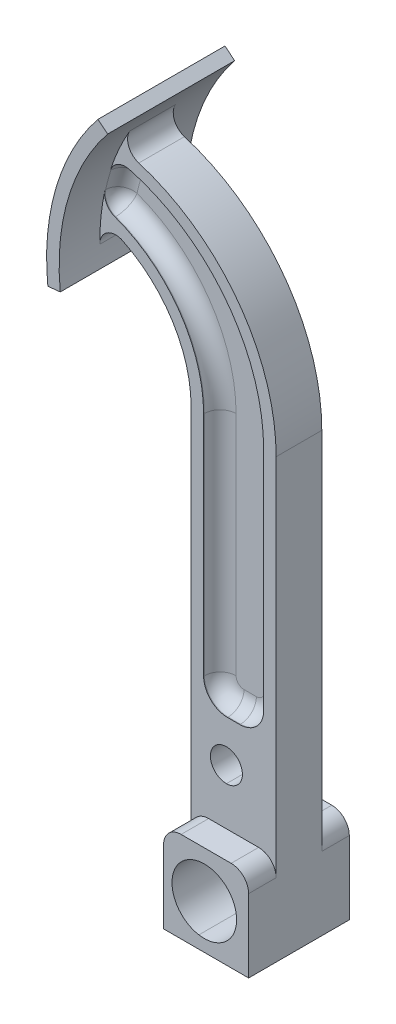
from build123d import *
from build123d.topology import SkipClean

# Parameters (mm, degrees)
SKETCH2_R               = 6.3999999999999995
SKETCH2_R_2             = 12.920000000000002
BOSS_EXTRUDE1_DEPTH     = 20.125
BOSS_EXTRUDE2_DEPTH     = 25.4
CUT_EXTRUDE1_DEPTH      = 17.625
FILLET2_R               = 9.525
FILLET1_R               = 6.35
FILLET2_OF_MIRROR1_R    = 9.525
FILLET1_OF_MIRROR1_R    = 6.35
CUT_EXTRUDE3_REACH      = 230.532
CUT_EXTRUDE3_END_RADIUS = 87.85596312436087
CUT_EXTRUDE4_DEPTH      = 34
FILLET3_R               = 6.35
CUT_EXTRUDE6_DEPTH      = 11
FILLET4_R               = 7


with BuildPart() as part:
    # Sketch2 → Boss-Extrude1 (new, symmetric)
    with BuildSketch(Plane.XY):
        with BuildLine():
            Line((-14.110000000000005, 117.05420999809479), (-14.110000000000003, 39.41472795492869))
            Line((-14.110000000000003, 39.41472795492869), (-14.109999999999992, -58.249999999999986))
            Line((-14.109999999999992, -58.24999999999999), (19.890000000000008, -58.24999999999999))
            Line((19.89000000000001, -58.24999999999999), (19.89000000000001, 39.414727954928686))
            Line((19.89000000000001, 39.41472795492869), (19.89000000000001, 116.74999999999999))
            ThreePointArc((19.890000000000022, 116.74999999999999), (2.3016026864285166, 165.96310053609741), (-42.49516565662927, 192.88020532941604))
            ThreePointArc((-42.49516565662924, 192.88020532941601), (-47.59126491681772, 178.8312081202326), (-50.2324931256602, 164.12173961174625))
            ThreePointArc((-50.23249312566025, 164.12173961174625), (-24.181503081041093, 146.71979128999487), (-14.110000000000007, 117.05420999809479))
        make_face()
        Circle(SKETCH2_R, mode=Mode.SUBTRACT)
        with Locations((2.160000000000005, -40.52)):
            Circle(SKETCH2_R_2, mode=Mode.SUBTRACT)
    extrude(amount=BOSS_EXTRUDE1_DEPTH, both=True)

    # Sketch2<3> → Boss-Extrude2 (add, symmetric)
    with BuildSketch(Plane.XY):
        with BuildLine():
            Line((-55.11000000000002, 146.4), (-50.13682514315135, 146.9172348047148))
            ThreePointArc((-50.13682514315135, 146.9172348047148), (-47.01837422138325, 180.86294224819565), (-31.213761902356293, 211.06641919101017))
            Line((-31.213761902356293, 211.06641919101017), (-35.11000000000003, 214.2))
            ThreePointArc((-35.11000000000003, 214.2), (-51.814073878435075, 182.27760291399264), (-55.11000000000002, 146.4))
        make_face()
    extrude(amount=BOSS_EXTRUDE2_DEPTH, both=True)

    # Sketch3 → Cut-Extrude1 (cut)
    with BuildSketch(Plane.XY.offset(20.125)):
        with BuildLine():
            Line((-9.109999999999992, 16.74326446705436), (-9.110000000000003, 117.05420999809479))
            ThreePointArc((-9.110000000000003, 117.05420999809479), (-20.430838112311193, 150.0432736077851), (-49.62239933784868, 169.12972028140788))
            ThreePointArc((-49.62239933784868, 169.12972028140788), (-47.60047450986274, 178.79694990145757), (-44.50629280792827, 188.17615819065796))
            ThreePointArc((-44.50629280792827, 188.17615819065796), (-1.899187077854016, 163.1978623652425), (14.890000000000011, 116.74999999999999))
            Line((14.890000000000011, 116.74999999999999), (14.890000000000011, 16.74326446705436))
            Line((14.890000000000011, 16.74326446705436), (-9.109999999999992, 16.74326446705436))
        make_face()
    cut_extrude1 = extrude(amount=-CUT_EXTRUDE1_DEPTH, mode=Mode.SUBTRACT)

    # Fillet2
    fillet2_edges = [part.edges().sort_by_distance(p)[0] for p in [
        (14.890000000000011, 16.74326446705436, 11.3125),
        (-9.109999999999992, 16.74326446705436, 11.3125),
    ]]
    fillet(fillet2_edges, radius=FILLET2_R)

    # Fillet1
    fillet1_edges = [part.edges().sort_by_distance(p)[0] for p in [
        (-20.430838112311193, 150.0432736077851, 2.5),
        (-47.600474509862764, 178.79694990145757, 2.5),
        (-49.62239933784869, 169.12972028140788, 11.3125),
        (-1.8991870778540232, 163.1978623652425, 2.5),
        (-44.506292807928276, 188.17615819065796, 11.3125),
        (-9.109999999999998, 71.66123723257456, 2.5),
        (2.8900000000000112, 16.74326446705436, 2.5),
        (14.890000000000011, 71.50913223352717, 2.5),
        (12.100192090801878, 19.53307237625249, 2.5),
        (-6.32019209080186, 19.53307237625249, 2.5),
    ]]
    fillet(fillet1_edges, radius=FILLET1_R)

    # Mirror1: Cut-Extrude1 across plane
    add(cut_extrude1.mirror(Plane.XY), mode=Mode.SUBTRACT)

    # Fillet2 of Mirror1
    fillet2_of_mirror1_edges = [part.edges().sort_by_distance(p)[0] for p in [
        (14.890000000000011, 16.74326446705436, -11.3125),
        (-9.109999999999992, 16.74326446705436, -11.3125),
    ]]
    fillet(fillet2_of_mirror1_edges, radius=FILLET2_OF_MIRROR1_R)

    # Fillet1 of Mirror1
    fillet1_of_mirror1_edges = [part.edges().sort_by_distance(p)[0] for p in [
        (-20.430838112311193, 150.0432736077851, -2.5),
        (-47.600474509862764, 178.79694990145757, -2.5),
        (-49.62239933784869, 169.12972028140788, -11.3125),
        (-1.8991870778540232, 163.1978623652425, -2.5),
        (-44.506292807928276, 188.17615819065796, -11.3125),
        (-9.109999999999998, 71.66123723257456, -2.5),
        (2.8900000000000112, 16.74326446705436, -2.5),
        (14.890000000000011, 71.50913223352717, -2.5),
        (12.100192090801878, 19.53307237625249, -2.5),
        (-6.32019209080186, 19.53307237625249, -2.5),
    ]]
    fillet(fillet1_of_mirror1_edges, radius=FILLET1_OF_MIRROR1_R)

    # Cut-Extrude3: up to this cylinder (the profile starts inside it)
    with SkipClean():  # the faces are left unmerged after this step: merging them gives an invalid solid
        cut_extrude3_end = Plane(origin=(37.24778822370744, 156.0056671906468, 17.416667), z_dir=(0, 0, -1)) * Cylinder(CUT_EXTRUDE3_END_RADIUS, 637.7759262487218, mode=Mode.PRIVATE)
        # Sketch5 → Cut-Extrude3 (cut, up to the surface)
        with BuildSketch(Plane(origin=(19.89000000000001, 0, 0), x_dir=(0, 0, -1), z_dir=(1, 0, 0)), mode=Mode.PRIVATE) as cut_extrude3_sk1:
            Polygon((-20.125, 29.25), (-12, 192.88020532941607), (-20.125, 192.88020532941607), align=None)
        cut_extrude3_tool1 = extrude(cut_extrude3_sk1.sketch, amount=-CUT_EXTRUDE3_REACH, mode=Mode.PRIVATE) & cut_extrude3_end
        cut_extrude3 = cut_extrude3_tool1.solids().sort_by_distance((19.89, 138.336804, 17.416667))[0]
        add(cut_extrude3, mode=Mode.SUBTRACT)

    # Sketch5<2> → Cut-Extrude4 (cut)
    with SkipClean():  # the faces are left unmerged after this step: merging them gives an invalid solid
        with BuildSketch(Plane(origin=(19.89000000000001, 0, 0), x_dir=(0, 0, -1), z_dir=(1, 0, 0))):
            Polygon((-20.125, 29.25), (-12, 192.88020532941607), (-20.125, 192.88020532941607), align=None)
        cut_extrude4 = extrude(amount=-CUT_EXTRUDE4_DEPTH, mode=Mode.SUBTRACT)

    # Mirror3: Cut-Extrude3, Cut-Extrude4 across plane
    with SkipClean():  # the faces are left unmerged after this step: merging them gives an invalid solid
        add(cut_extrude3.mirror(Plane.XY), mode=Mode.SUBTRACT)
        add(cut_extrude4.mirror(Plane.XY), mode=Mode.SUBTRACT)

    # Fillet3
    # the kernel refuses this fillet: 6.35 mm, written as the material it adds along each edge
    with BuildSketch(Plane(origin=(-42.49516565662923, 192.88020532941607, 32.81193482848439), x_dir=(0.9695328883801022, -0.24496117722883434, 0), z_dir=(0, 0, -1))) as fillet3_piece_1_section:
        with BuildLine():
            CenterArc((8.024480114111293, -6.3421701367020615), FILLET3_R, 92.84559109505132, 103.22260019601504)
            ThreePointArc((1.922555805727569, -8.099730871002809), (0.8652879633419357, -4.072649651231302), (0, 0))
            ThreePointArc((0, 0), (3.854618709259254, -0.0957393715417783), (7.709237418518542, 1.1e-16))
        make_face()
    fillet3_piece_1 = extrude(amount=65.62386965696876, mode=Mode.PRIVATE)
    fillet3_piece_1 = split(fillet3_piece_1, bisect_by=Plane(origin=(-39.886829020293874, 194.82853980671922, 11.903256140293786), z_dir=(0, -0.04959354560053897, -0.9987694830313786)), keep=Keep.TOP, mode=Mode.PRIVATE)
    fillet3_piece_1 = split(fillet3_piece_1, bisect_by=Plane(origin=(-39.886829020293874, 194.82853980671922, -11.903256140293786), z_dir=(0, -0.04959354560053897, 0.9987694830313786)), keep=Keep.TOP, mode=Mode.PRIVATE)
    add(fillet3_piece_1)
    with BuildSketch(Plane(origin=(-50.2324931256602, 164.12173961174625, -36.817821832007795), x_dir=(0.9366748288378645, -0.3502003212756337, 0), z_dir=(0, 0, 1))) as fillet3_piece_2_section:
        with BuildLine():
            CenterArc((8.74629308675495, -6.320667702743433), FILLET3_R, 84.49076719702147, 116.61848813582492)
            ThreePointArc((2.822407485998928, -8.607604385110362), (1.3001924139031467, -4.340202472151455), (0, 0))
            ThreePointArc((0, 0), (4.6779660766656175, 0.2250766052239502), (9.355932153331263, 2.8e-16))
        make_face()
    fillet3_piece_2 = extrude(amount=73.63564366401559, mode=Mode.PRIVATE)
    fillet3_piece_2 = split(fillet3_piece_2, bisect_by=Plane(origin=(-48.29188317260997, 162.0247617991737, 13.532116140650901), z_dir=(0, -0.04959354560053897, -0.9987694830313786)), keep=Keep.TOP, mode=Mode.PRIVATE)
    fillet3_piece_2 = split(fillet3_piece_2, bisect_by=Plane(origin=(-48.29188317260997, 162.02476179917375, -13.5321161406509), z_dir=(0, -0.04959354560053897, 0.9987694830313786)), keep=Keep.TOP, mode=Mode.PRIVATE)
    add(fillet3_piece_2)

    # Sketch7 → Cut-Extrude6 (cut)
    with SkipClean():  # the faces are left unmerged after this step: merging them gives an invalid solid
        with BuildSketch(Plane.XY.offset(20.125)):
            with BuildLine():
                Line((-22.47666315598992, -22.034869971016057), (33.32085672898189, -22.034869971016057))
                Line((33.32085672898189, -22.034869971016057), (33.32085672898189, 196.87887338600035))
                Line((33.32085672898189, 196.87887338600035), (-31.213761902356293, 211.06641919101017))
                ThreePointArc((-31.213761902356293, 211.06641919101017), (-47.01837422138329, 180.8629422481957), (-50.13682514315135, 146.9172348047148))
                Line((-50.13682514315135, 146.9172348047148), (-22.47666315598992, -22.034869971016057))
            make_face()
        cut_extrude6 = extrude(amount=-CUT_EXTRUDE6_DEPTH, mode=Mode.SUBTRACT)

    # Mirror4: Cut-Extrude6 across plane
    with SkipClean():  # the faces are left unmerged after this step: merging them gives an invalid solid
        add(cut_extrude6.mirror(Plane.XY), mode=Mode.SUBTRACT)

    # Fillet4
    fillet4_edges = [part.edges().sort_by_distance(p)[0] for p in [
        (-14.110000000000001, -22.03486997101606, 14.625),
        (19.89000000000001, -22.034869971016057, 14.625),
        (19.89000000000001, -22.034869971016057, -14.625),
        (-14.110000000000001, -22.03486997101606, -14.625),
    ]]
    fillet(fillet4_edges, radius=FILLET4_R)


solid = part.part
